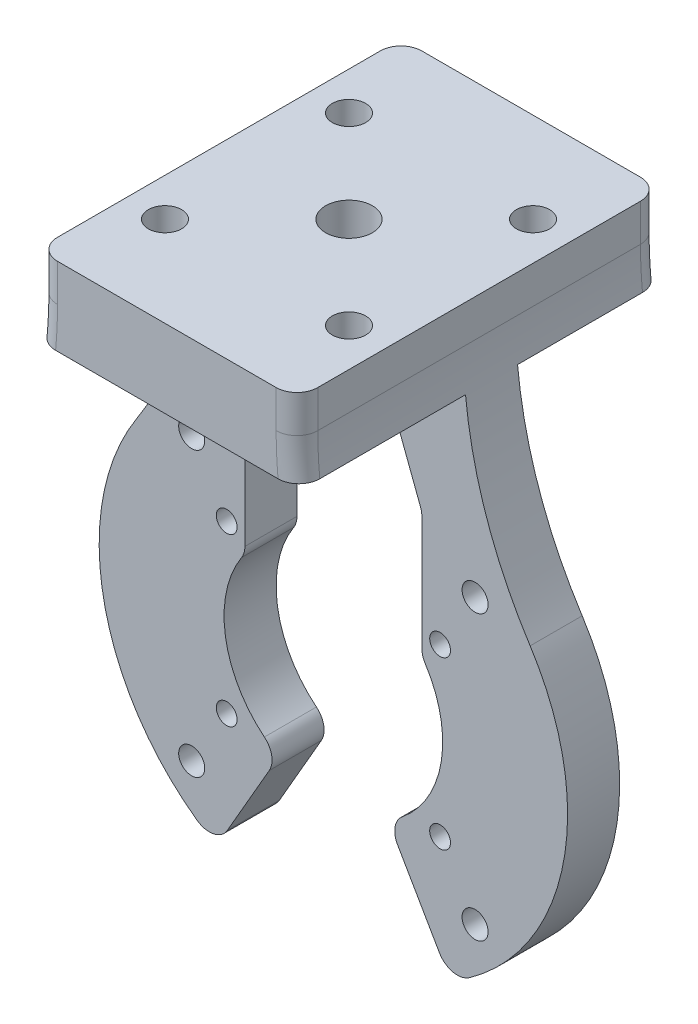
from build123d import *

# Parameters (mm, degrees)
SKETCH_1_R                   = 1.25
SKETCH_1_R_2                 = 1
EXTRUDE_1_DEPTH              = 5
SKETCH_3_W                   = 35
SKETCH_3_H                   = 7.5
EXTRUDE_2_DEPTH              = 12.5
SKETCH_5_R                   = 2.25
CUT_EXTRUDE_1_DEPTH          = 7.5
FILLET_2_R                   = 40
HOLE_WIZARD_M3_1_D           = 3.2
HOLE_WIZARD_M3_1_CBORE_D     = 6
HOLE_WIZARD_M3_1_CBORE_DEPTH = 3.4
CUT_EXTRUDE_2_DEPTH          = 48.681233206
FILLET_1_R                   = 2


with BuildPart() as part:
    # 草图1 → 凸台-拉伸1 (new body)
    # profile 1 of 2: a face of its own
    with BuildSketch(Plane.XY):
        with BuildLine():
            ThreePointArc((12.5, 18.708286934), (0, 22.5), (-12.5, 18.708286934))
            ThreePointArc((-12.5, 18.708286934), (-22.487606156, -0.746705683), (-11.231408892, -19.496293348))
            Line((-11.231408892, -19.496293348), (-5.24132415, -9.098270229))
            ThreePointArc((-5.24132415, -9.098270229), (-5.254336134, 9.090761892), (10.5, 0))
            ThreePointArc((10.5, 0), (9.090761892, -5.254336134), (5.24132415, -9.098270229))
            Line((5.24132415, -9.098270229), (11.231408892, -19.496293348))
            ThreePointArc((11.231408892, -19.496293348), (19.480204055, -11.259291717), (22.5, 0))
            ThreePointArc((22.5, 0), (19.843134833, 10.606601718), (12.5, 18.708286934))
        make_face()
        with Locations((-13.611805538, -13.611805538)):
            Circle(SKETCH_1_R, mode=Mode.SUBTRACT)
        with Locations((-10.25, -8)):
            Circle(SKETCH_1_R_2, mode=Mode.SUBTRACT)
        with Locations((10.25, -8)):
            Circle(SKETCH_1_R_2, mode=Mode.SUBTRACT)
        with Locations((13.611805538, -13.611805538)):
            Circle(SKETCH_1_R, mode=Mode.SUBTRACT)
        with Locations((-13.611805538, 13.611805538)):
            Circle(SKETCH_1_R, mode=Mode.SUBTRACT)
        with Locations((-10.25, 8)):
            Circle(SKETCH_1_R_2, mode=Mode.SUBTRACT)
        with Locations((10.25, 8)):
            Circle(SKETCH_1_R_2, mode=Mode.SUBTRACT)
        with Locations((13.611805538, 13.611805538)):
            Circle(SKETCH_1_R, mode=Mode.SUBTRACT)
    # profile 2 of 2: a face of its own
    with BuildSketch(Plane.XY):
        with BuildLine():
            Line((-12.5, 37.5), (-12.5, 18.708286934))
            ThreePointArc((-12.5, 18.708286934), (0, 22.5), (12.5, 18.708286934))
            Line((12.5, 18.708286934), (12.5, 37.5))
            Line((12.5, 37.5), (-12.5, 37.5))
        make_face()
    extrude(amount=EXTRUDE_1_DEPTH)

    # 草图3 → 凸台-拉伸2 (add, symmetric)
    with BuildSketch(Plane(origin=(0, 0, 0), x_dir=(0, 0, -1), z_dir=(1, 0, 0))):
        with Locations((-3.5, 33.75)):
            Rectangle(SKETCH_3_W, SKETCH_3_H)
    extrude(amount=EXTRUDE_2_DEPTH, both=True)

    # 草图5 → 切除-拉伸1 (cut, symmetric)
    with BuildSketch(Plane.XZ.offset(-30)):
        with Locations(Location((0, 3.5, 0), (0, 0, 270))):
            Circle(SKETCH_5_R)
    extrude(amount=CUT_EXTRUDE_1_DEPTH, both=True, mode=Mode.SUBTRACT)

    # 圆角2
    # the kernel refuses this fillet: 40 mm, written as the material it adds along each edge
    with BuildSketch(Plane(origin=(-12.5, 18.708286934, -38.008407454), x_dir=(-0.7015991579933682, -0.7125718360298817, 0), z_dir=(0, 0, 1))) as fillet_2_piece_1_section:
        with BuildLine():
            CenterArc((17.230478046, -39.169540108), FILLET_2_R, 101.695565513, 32.859880379)
            Line((-10.833488274, -10.666666667), (0, 0))
            ThreePointArc((0, 0), (4.561008895, -0.467133689), (9.122017789, 0))
        make_face()
    fillet_2_piece_1 = extrude(amount=43.008407454, mode=Mode.PRIVATE)
    fillet_2_piece_1 = split(fillet_2_piece_1, bisect_by=Plane(origin=(-12.133812824, 31.883513777, 0), z_dir=(0, 0, -1)), keep=Keep.TOP, mode=Mode.PRIVATE)
    fillet_2_piece_1 = split(fillet_2_piece_1, bisect_by=Plane(origin=(-12.133812824, 30, -7), z_dir=(0, 1, 0)), keep=Keep.TOP, mode=Mode.PRIVATE)
    fillet_2_piece_1 = split(fillet_2_piece_1, bisect_by=Plane(origin=(-12.133812824, 31.883513777, -14), z_dir=(0, 0, 1)), keep=Keep.TOP, mode=Mode.PRIVATE)
    add(fillet_2_piece_1)
    with BuildSketch(Plane(origin=(-12.5, 18.708286934, 0), x_dir=(-0.7015991579933694, -0.7125718360298806, 0), z_dir=(0, 0, 1))) as fillet_2_piece_2_section:
        with BuildLine():
            CenterArc((17.230478046, -39.169540108), FILLET_2_R, 101.695565513, 32.859880379)
            Line((-10.833488274, -10.666666667), (0, 0))
            ThreePointArc((0, 0), (4.561008895, -0.467133689), (9.122017789, 0))
        make_face()
    fillet_2_piece_2 = extrude(amount=5, mode=Mode.PRIVATE)
    fillet_2_piece_2 = split(fillet_2_piece_2, bisect_by=Plane(origin=(-13.82835822, 30, 2.5), z_dir=(0, -1, 0)), keep=Keep.TOP, mode=Mode.PRIVATE)
    add(fillet_2_piece_2)
    with BuildSketch(Plane(origin=(-12.5, 18.708286934, 0), x_dir=(-0.7015991579933694, -0.7125718360298806, 0), z_dir=(0, 0, 1))) as fillet_2_piece_3_section:
        with BuildLine():
            CenterArc((17.230478046, -39.169540108), FILLET_2_R, 101.695565513, 32.859880379)
            Line((-10.833488274, -10.666666667), (0, 0))
            ThreePointArc((0, 0), (4.561008895, -0.467133689), (9.122017789, 0))
        make_face()
    fillet_2_piece_3 = extrude(amount=5, mode=Mode.PRIVATE)
    fillet_2_piece_3 = split(fillet_2_piece_3, bisect_by=Plane(origin=(-12.133812824, 30, 2.5), z_dir=(0, 1, 0)), keep=Keep.TOP, mode=Mode.PRIVATE)
    add(fillet_2_piece_3)
    with BuildSketch(Plane(origin=(-12.5, 18.708286934, 0), x_dir=(-0.7015991579933694, -0.7125718360298806, 0), z_dir=(0, 0, 1))) as fillet_2_piece_4_section:
        with BuildLine():
            CenterArc((17.230478046, -39.169540108), FILLET_2_R, 101.695565513, 32.859880379)
            Line((-10.833488274, -10.666666667), (0, 0))
            ThreePointArc((0, 0), (4.561008895, -0.467133689), (9.122017789, 0))
        make_face()
    fillet_2_piece_4 = extrude(amount=43.008407454, mode=Mode.PRIVATE)
    fillet_2_piece_4 = split(fillet_2_piece_4, bisect_by=Plane(origin=(-12.133812824, 31.883513777, 5), z_dir=(0, 0, 1)), keep=Keep.TOP, mode=Mode.PRIVATE)
    fillet_2_piece_4 = split(fillet_2_piece_4, bisect_by=Plane(origin=(-12.133812824, 30, 13), z_dir=(0, 1, 0)), keep=Keep.TOP, mode=Mode.PRIVATE)
    fillet_2_piece_4 = split(fillet_2_piece_4, bisect_by=Plane(origin=(-12.133812824, 31.883513777, 21), z_dir=(0, 0, -1)), keep=Keep.TOP, mode=Mode.PRIVATE)
    add(fillet_2_piece_4)
    with BuildSketch(Plane(origin=(12.5, 18.708286934, -38.008407454), x_dir=(0.7015991579933666, -0.7125718360298834, 0), z_dir=(0, 0, 1))) as fillet_2_piece_5_section:
        with BuildLine():
            CenterArc((17.230478046, 39.169540108), FILLET_2_R, 225.444554108, 32.859880379)
            Line((-10.833488274, 10.666666667), (0, 0))
            ThreePointArc((0, 0), (4.561008895, 0.467133689), (9.122017789, 0))
        make_face()
    fillet_2_piece_5 = extrude(amount=43.008407454, mode=Mode.PRIVATE)
    fillet_2_piece_5 = split(fillet_2_piece_5, bisect_by=Plane(origin=(12.133812824, 31.883513777, 0), z_dir=(0, 0, -1)), keep=Keep.TOP, mode=Mode.PRIVATE)
    fillet_2_piece_5 = split(fillet_2_piece_5, bisect_by=Plane(origin=(12.133812824, 30, -7), z_dir=(0, 1, 0)), keep=Keep.TOP, mode=Mode.PRIVATE)
    fillet_2_piece_5 = split(fillet_2_piece_5, bisect_by=Plane(origin=(12.133812824, 31.883513777, -14), z_dir=(0, 0, 1)), keep=Keep.TOP, mode=Mode.PRIVATE)
    add(fillet_2_piece_5)
    with BuildSketch(Plane(origin=(12.5, 18.708286934, 0), x_dir=(0.7015991579933667, -0.7125718360298833, 0), z_dir=(0, 0, 1))) as fillet_2_piece_6_section:
        with BuildLine():
            CenterArc((17.230478046, 39.169540108), FILLET_2_R, 225.444554108, 32.859880379)
            Line((-10.833488274, 10.666666667), (0, 0))
            ThreePointArc((0, 0), (4.561008895, 0.467133689), (9.122017789, 0))
        make_face()
    fillet_2_piece_6 = extrude(amount=5, mode=Mode.PRIVATE)
    fillet_2_piece_6 = split(fillet_2_piece_6, bisect_by=Plane(origin=(13.82835822, 30, 2.5), z_dir=(0, -1, 0)), keep=Keep.TOP, mode=Mode.PRIVATE)
    add(fillet_2_piece_6)
    with BuildSketch(Plane(origin=(12.5, 18.708286934, 0), x_dir=(0.7015991579933667, -0.7125718360298833, 0), z_dir=(0, 0, 1))) as fillet_2_piece_7_section:
        with BuildLine():
            CenterArc((17.230478046, 39.169540108), FILLET_2_R, 225.444554108, 32.859880379)
            Line((-10.833488274, 10.666666667), (0, 0))
            ThreePointArc((0, 0), (4.561008895, 0.467133689), (9.122017789, 0))
        make_face()
    fillet_2_piece_7 = extrude(amount=5, mode=Mode.PRIVATE)
    fillet_2_piece_7 = split(fillet_2_piece_7, bisect_by=Plane(origin=(12.133812824, 30, 2.5), z_dir=(0, 1, 0)), keep=Keep.TOP, mode=Mode.PRIVATE)
    add(fillet_2_piece_7)
    with BuildSketch(Plane(origin=(12.5, 18.708286934, 0), x_dir=(0.7015991579933667, -0.7125718360298833, 0), z_dir=(0, 0, 1))) as fillet_2_piece_8_section:
        with BuildLine():
            CenterArc((17.230478046, 39.169540108), FILLET_2_R, 225.444554108, 32.859880379)
            Line((-10.833488274, 10.666666667), (0, 0))
            ThreePointArc((0, 0), (4.561008895, 0.467133689), (9.122017789, 0))
        make_face()
    fillet_2_piece_8 = extrude(amount=43.008407454, mode=Mode.PRIVATE)
    fillet_2_piece_8 = split(fillet_2_piece_8, bisect_by=Plane(origin=(12.133812824, 31.883513777, 5), z_dir=(0, 0, 1)), keep=Keep.TOP, mode=Mode.PRIVATE)
    fillet_2_piece_8 = split(fillet_2_piece_8, bisect_by=Plane(origin=(12.133812824, 30, 13), z_dir=(0, 1, 0)), keep=Keep.TOP, mode=Mode.PRIVATE)
    fillet_2_piece_8 = split(fillet_2_piece_8, bisect_by=Plane(origin=(12.133812824, 31.883513777, 21), z_dir=(0, 0, -1)), keep=Keep.TOP, mode=Mode.PRIVATE)
    add(fillet_2_piece_8)

    # M3 六角圆柱头螺钉的柱形沉头孔1 (through all)
    with Locations(Plane(origin=(0, 30, 0), x_dir=(-1, 0, 0), z_dir=(0, -1, 0))):
        with Locations((8.838834765, -12.338834765), (-8.838834765, -12.338834765), (-8.838834765, 5.338834765), (8.838834765, 5.338834765)):
            CounterBoreHole(HOLE_WIZARD_M3_1_D / 2, HOLE_WIZARD_M3_1_CBORE_D / 2, HOLE_WIZARD_M3_1_CBORE_DEPTH)

    # 草图9 → 切除-拉伸2 (cut, through all)
    with BuildSketch(Plane.XY.offset(5)):
        Polygon((-4, 30), (-8.5, 18.164414003), (-8.5, 6.164414003), (8.5, 6.164414003), (8.5, 18.164414003), (4, 30), align=None)
    extrude(amount=-CUT_EXTRUDE_2_DEPTH, mode=Mode.SUBTRACT)

    # 圆角1
    fillet_1_edges = [part.edges().sort_by_distance(p)[0] for p in [
        (8.5, 6.164414003, 2.5),
        (-8.5, 6.164414003, 2.5),
        (-8.5, 18.164414003, 2.5),
        (4, 30, 2.5),
        (8.5, 18.164414003, 2.5),
        (-4, 30, 2.5),
        (11.231408892, -19.496293348, 2.5),
        (5.24132415, -9.098270229, 2.5),
        (-5.24132415, -9.098270229, 2.5),
        (-11.231408892, -19.496293348, 2.5),
        (-12.5, 35.705824958, 21),
        (12.5, 35.705824958, 21),
        (-12.5, 35.705824958, -14),
        (12.5, 35.705824958, -14),
        (-12.547959259, 31.953477145, -14),
        (-12.547959259, 31.953477145, 21),
        (12.547959259, 31.953477145, -14),
        (12.547959259, 31.953477145, 21),
    ]]
    fillet(fillet_1_edges, radius=FILLET_1_R)


solid = part.part
